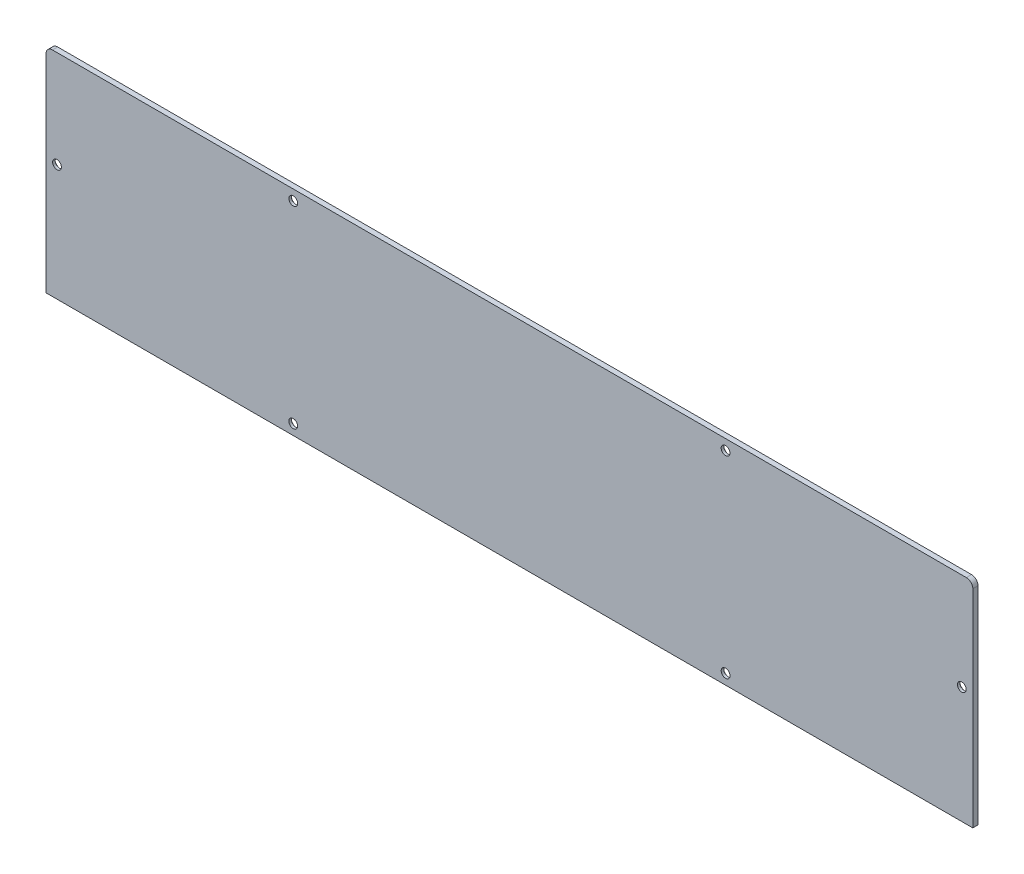
from build123d import *

# Parameters (mm, degrees)
EXTRUDE_1_DEPTH            = 2
HOLE_WIZARD_2_D            = 3.4
HOLE_WIZARD_2_DEPTH        = 7.5
HOLE_WIZARD_2_CBORE_D      = 6
HOLE_WIZARD_2_CBORE_DEPTH  = 1
HOLE_WIZARD_2_TIP          = 1.021463052
CUT_EXTRUDE_1_DEPTH        = 293.02858542
HOLE_WIZARD_2_2_AT_2_COUNT = 2
HOLE_WIZARD_2_2_AT_2_PITCH = 167


with BuildPart() as part:
    # 草图1 → 凸台-拉伸1 (new body)
    with BuildSketch(Plane(origin=(0, 0, 222.724508868), x_dir=(-1, 0, 0), z_dir=(0, 0, -1))):
        with BuildLine():
            Line((-76.251869293, -10), (282.750233779, -10))
            Line((282.750233779, -10), (282.750233779, 70))
            ThreePointArc((282.750233779, 70), (281.871554123, 72.121320344), (279.750233779, 73))
            Line((279.750233779, 73), (-73.251869293, 73))
            ThreePointArc((-73.251869293, 73), (-75.373189637, 72.121320344), (-76.251869293, 70))
            Line((-76.251869293, 70), (-76.251869293, -10))
        make_face()
    extrude(amount=EXTRUDE_1_DEPTH)

    # Hole Wizard 2
    with Locations(Plane(origin=(71.501869293, 35, 220.724508868), x_dir=(-1, 0, 0), z_dir=(0, 0, -1))):
        with Locations((0, 0), (91.251051536, 33.5), (258.251051536, 33.5), (349.502103072, 0)):
            CounterBoreHole(HOLE_WIZARD_2_D / 2, HOLE_WIZARD_2_CBORE_D / 2, HOLE_WIZARD_2_CBORE_DEPTH, depth=HOLE_WIZARD_2_DEPTH)
            with Locations((0, 0, -(HOLE_WIZARD_2_DEPTH + HOLE_WIZARD_2_TIP / 2))):  # 118° drill point
                Cone(0, HOLE_WIZARD_2_D / 2, HOLE_WIZARD_2_TIP, mode=Mode.SUBTRACT)

    # 草图4 → 切除-拉伸1 (cut, through all)
    with BuildSketch(Plane(origin=(0, 0, 220.724508868), x_dir=(-1, 0, 0), z_dir=(0, 0, -1))):
        with BuildLine():
            Line((-76.251869293, 70), (-76.251869293, -10))
            Line((-76.251869293, -10), (-75.751869293, -10))
            Line((-75.751869293, -10), (-75.751869293, 70))
            ThreePointArc((-75.751869293, 70), (-75.019636246, 71.767766953), (-73.251869293, 72.5))
            Line((-73.251869293, 72.5), (279.750233779, 72.5))
            ThreePointArc((279.750233779, 72.5), (281.518000732, 71.767766953), (282.250233779, 70))
            Line((282.250233779, 70), (282.250233779, -10))
            Line((282.250233779, -10), (282.750233779, -10))
            Line((282.750233779, -10), (282.750233779, 70))
            ThreePointArc((282.750233779, 70), (281.871554123, 72.121320344), (279.750233779, 73))
            Line((279.750233779, 73), (-73.251869293, 73))
            ThreePointArc((-73.251869293, 73), (-75.373189637, 72.121320344), (-76.251869293, 70))
        make_face()
    extrude(amount=-CUT_EXTRUDE_1_DEPTH, mode=Mode.SUBTRACT)

    # 草图5 → Hole Wizard 2 2 (revolve, cut)
    with BuildSketch(Plane(origin=(-19.749182243, -6, 220.724508868), x_dir=(0, 1, 0), z_dir=(1, 0, 0))):
        Polygon((0, 0), (0, 20.521463052), (1.7, 19.5), (1.7, 1), (3, 1), (3, 0), align=None)
    hole_wizard_2_2 = revolve(axis=Axis((-19.749182243, -6, 214.374508868), (0, 0, 1)), mode=Mode.SUBTRACT)

    # Hole Wizard 2 2 at 2: Hole Wizard 2 2 ×2
    with Locations(*[(-i * HOLE_WIZARD_2_2_AT_2_PITCH, 0, 0) for i in range(1, HOLE_WIZARD_2_2_AT_2_COUNT)]):
        add(hole_wizard_2_2, mode=Mode.SUBTRACT)


solid = part.part
